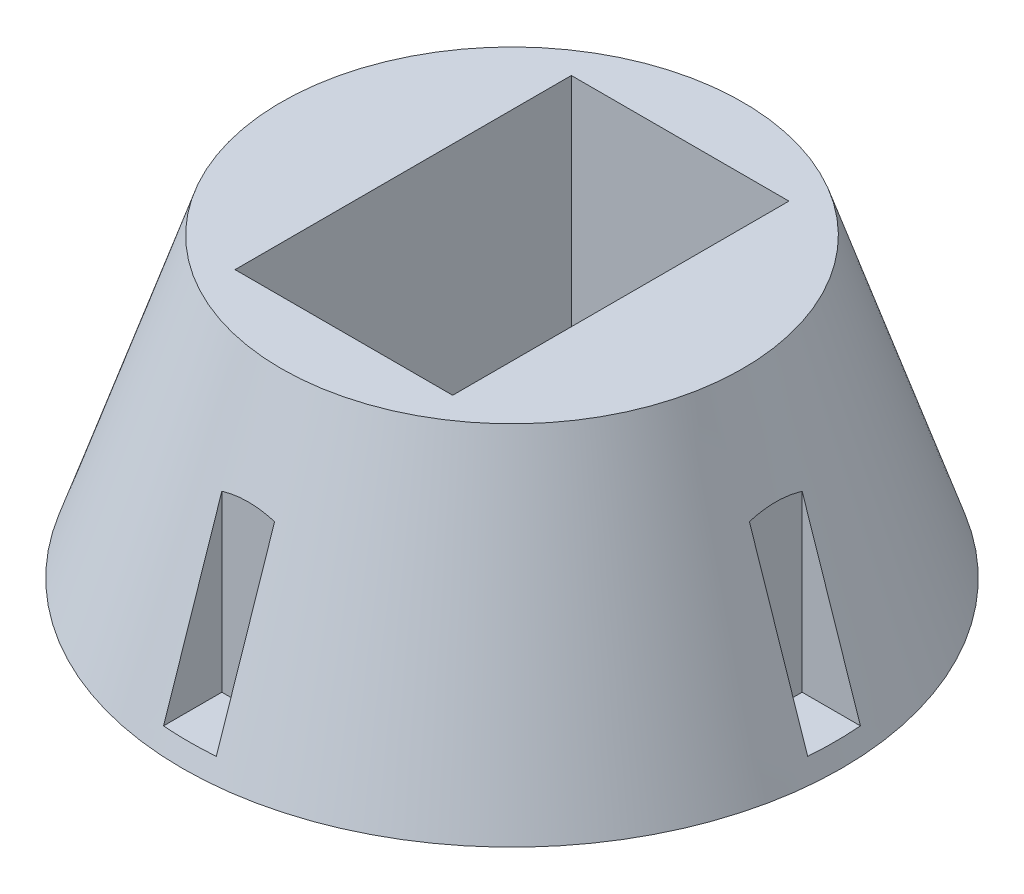
from build123d import *

# Parameters (mm, degrees)
ESQUISSE2_W             = 33
ESQUISSE2_H             = 51
ENL_V_MAT_EXTRU_1_DEPTH = 41
ESQUISSE3_W             = 8
ESQUISSE3_H             = 12
ESQUISSE3_W_2           = 12
ESQUISSE3_H_2           = 8
ENL_V_MAT_EXTRU_3_DEPTH = 42
ESQUISSE4_W             = 23.524420498
ESQUISSE4_H             = 14.572913479
ENL_V_MAT_EXTRU_4_DEPTH = 269


with BuildPart() as part:
    # Esquisse1 → Révolution1 (revolve)
    with BuildSketch(Plane.XY):
        Polygon((0, 0), (-50, 0), (-35, 45), (0, 45), align=None)
    revolve(axis=Axis((0, 185.624886126, 0), (0, -1, 0)))

    # Esquisse2 → Enlèv. mat.-Extru.1 (cut)
    with BuildSketch(Plane(origin=(0, 45, 0), x_dir=(1, 0, 0), z_dir=(0, 1, 0))):
        Rectangle(ESQUISSE2_W, ESQUISSE2_H)
    extrude(amount=-ENL_V_MAT_EXTRU_1_DEPTH, mode=Mode.SUBTRACT)

    # Esquisse3 → Enlèv. mat.-Extru.3 (cut)
    with BuildSketch(Plane(origin=(0, 45, 0), x_dir=(1, 0, 0), z_dir=(0, 1, 0))):
        with Locations((0, 46)):
            Rectangle(ESQUISSE3_W, ESQUISSE3_H)
        with Locations((46, 0)):
            Rectangle(ESQUISSE3_W_2, ESQUISSE3_H_2)
        with Locations((0, -46)):
            Rectangle(ESQUISSE3_W, ESQUISSE3_H)
        with Locations((-46, 0)):
            Rectangle(ESQUISSE3_W_2, ESQUISSE3_H_2)
    extrude(amount=-ENL_V_MAT_EXTRU_3_DEPTH, mode=Mode.SUBTRACT)

    # Esquisse4 → Enlèv. mat.-Extru.4 (cut)
    with BuildSketch(Plane(origin=(0, 4, 0), x_dir=(1, 0, 0), z_dir=(0, 1, 0))):
        with Locations((-1.026102351, -0.627863405)):
            Rectangle(ESQUISSE4_W, ESQUISSE4_H)
    extrude(amount=-ENL_V_MAT_EXTRU_4_DEPTH, mode=Mode.SUBTRACT)


solid = part.part
